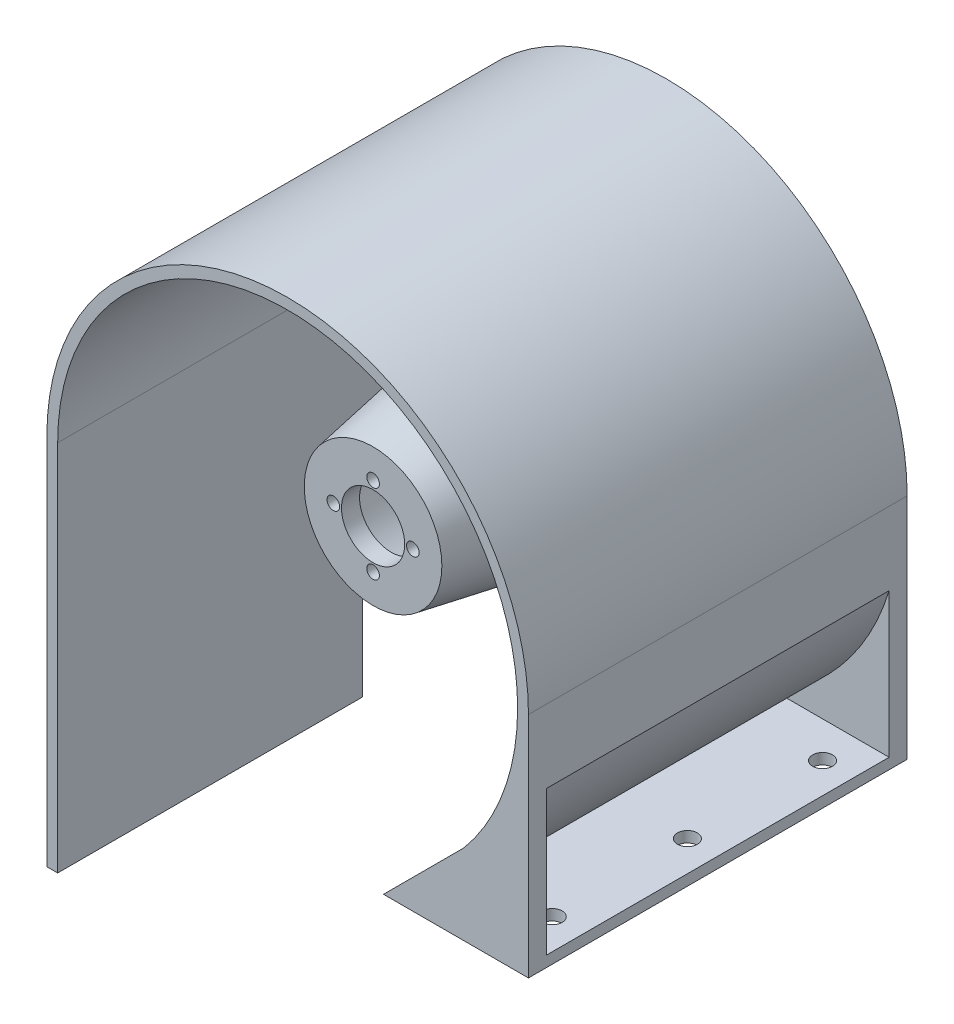
from build123d import *

# Parameters (mm, degrees)
BOSS_EXTRUDE1_DEPTH = 104.85
CUT_EXTRUDE1_REACH  = 178.992
CUT_EXTRUDE2_REACH  = 178.992
SKETCH3_R           = 2.665000000000001
BOSS_EXTRUDE2_DEPTH = 104.85
CUT_EXTRUDE3_REACH  = 178.992
SKETCH6_W           = 66.67499999999998
SKETCH6_H           = 36.500000000000014
CUT_EXTRUDE4_DEPTH  = 3.5
CUT_EXTRUDE5_DEPTH  = 94.850000094
SKETCH9_R           = 2.7500000000000084
SKETCH9_R_2         = 2.750000000000008
CUT_EXTRUDE6_DEPTH  = 5
CUT_EXTRUDE7_DEPTH  = 99.85
BOSS_EXTRUDE3_DEPTH = 40
SKETCH12_R          = 19.05
BOSS_EXTRUDE4_DEPTH = 76.2
CHAMFER1_SIZE       = 13.43611593
CHAMFER1_SIZE_2     = 76.2
CUT_EXTRUDE8_REACH  = 166.091
SKETCH13_R          = 8.750000000000004
CUT_EXTRUDE9_REACH  = 166.091
SKETCH14_R          = 1.7500000000000038
SKETCH14_R_2        = 1.7500000000000067
SKETCH14_R_3        = 1.7499999999999987


# Read off the part's stored shape, not the designer's step: Shell1
with BuildPart() as part:
    # Sketch1 → Boss-Extrude1 (new body)
    with BuildSketch(Plane.XY):
        with BuildLine():
            Line((-34.925, 0), (-34.92499999999999, -63.5))
            Line((-34.92499999999999, -63.5), (-34.92499999999998, -103.175))
            Line((-34.92499999999998, -103.175), (98.425, -103.175))
            Line((98.425, -103.175), (98.42499999999998, -64.83388883768319))
            Line((98.42499999999998, -64.83388883768319), (98.425, 0))
            ThreePointArc((98.425, 0), (31.750000000000004, 66.675), (-34.925, 0))
        make_face()
    extrude(amount=BOSS_EXTRUDE1_DEPTH)

    # Sketch2 → Cut-Extrude1 (cut, up to next)
    with BuildSketch(Plane.XY.offset(104.85), mode=Mode.PRIVATE) as cut_extrude1_sk1:
        with BuildLine():
            Line((31.75, -66.675), (31.75, -103.175))
            Line((31.75, -103.175), (98.425, -103.175))
            Line((98.425, -103.175), (98.425, 0))
            ThreePointArc((98.425, 0), (78.89634463561305, -47.14634463561305), (31.75, -66.675))
        make_face()
    cut_extrude1_tool1 = extrude(cut_extrude1_sk1.sketch, amount=-CUT_EXTRUDE1_REACH, mode=Mode.PRIVATE) & part.part
    add(cut_extrude1_tool1.solids().sort_by_distance((70.281775, -75.59134, 104.85))[0], mode=Mode.SUBTRACT)

    # Sketch3 → Cut-Extrude2 (cut, up to next)
    with BuildSketch(Plane(origin=(0, 0, 0), x_dir=(-1, 0, 0), z_dir=(0, 0, -1)), mode=Mode.PRIVATE) as cut_extrude2_sk1:
        with Locations((-21.75, -93.17500000000001)):
            Circle(SKETCH3_R)
    cut_extrude2_tool1 = extrude(cut_extrude2_sk1.sketch, amount=-CUT_EXTRUDE2_REACH, mode=Mode.PRIVATE) & part.part
    # Sketch3 → Cut-Extrude2 (cut, up to next)
    with BuildSketch(Plane(origin=(0, 0, 0), x_dir=(-1, 0, 0), z_dir=(0, 0, -1)), mode=Mode.PRIVATE) as cut_extrude2_sk2:
        with Locations(Location((-21.75, -73.17499999999998, 0), (0, 0, 180))):
            Circle(SKETCH3_R)
    cut_extrude2_tool2 = extrude(cut_extrude2_sk2.sketch, amount=-CUT_EXTRUDE2_REACH, mode=Mode.PRIVATE) & part.part
    # Sketch3 → Cut-Extrude2 (cut, up to next)
    with BuildSketch(Plane(origin=(0, 0, 0), x_dir=(-1, 0, 0), z_dir=(0, 0, -1)), mode=Mode.PRIVATE) as cut_extrude2_sk3:
        with Locations(Location((24.924999999999997, -93.17500000000001, 0), (0, 0, 180))):
            Circle(SKETCH3_R)
    cut_extrude2_tool3 = extrude(cut_extrude2_sk3.sketch, amount=-CUT_EXTRUDE2_REACH, mode=Mode.PRIVATE) & part.part
    # Sketch3 → Cut-Extrude2 (cut, up to next)
    with BuildSketch(Plane(origin=(0, 0, 0), x_dir=(-1, 0, 0), z_dir=(0, 0, -1)), mode=Mode.PRIVATE) as cut_extrude2_sk4:
        with Locations((24.924999999999997, -73.17499999999998)):
            Circle(SKETCH3_R)
    cut_extrude2_tool4 = extrude(cut_extrude2_sk4.sketch, amount=-CUT_EXTRUDE2_REACH, mode=Mode.PRIVATE) & part.part
    add(cut_extrude2_tool1.solids().sort_by_distance((21.75, -93.175, 0))[0], mode=Mode.SUBTRACT)
    add(cut_extrude2_tool2.solids().sort_by_distance((21.75, -73.175, 0))[0], mode=Mode.SUBTRACT)
    add(cut_extrude2_tool3.solids().sort_by_distance((-24.925, -93.175, 0))[0], mode=Mode.SUBTRACT)
    add(cut_extrude2_tool4.solids().sort_by_distance((-24.925, -73.175, 0))[0], mode=Mode.SUBTRACT)

    # Sketch5 → Boss-Extrude2 (add)
    with BuildSketch(Plane(origin=(0, 0, 0), x_dir=(-1, 0, 0), z_dir=(0, 0, -1))):
        with BuildLine():
            Line((-31.75, -66.675), (-98.425, -66.675))
            Line((-98.425, -66.675), (-98.425, -4.6559e-13))
            ThreePointArc((-98.425, -4.6559e-13), (-78.89634463561288, -47.146344635613225), (-31.75, -66.675))
        make_face()
    extrude(amount=-BOSS_EXTRUDE2_DEPTH)

    # Sketch6 → Cut-Extrude3 (cut, up to next)
    with BuildSketch(Plane(origin=(0, 0, 0), x_dir=(-1, 0, 0), z_dir=(0, 0, -1)), mode=Mode.PRIVATE) as cut_extrude3_sk1:
        with Locations((1.5874999999999897, -84.92500000000001)):
            Rectangle(SKETCH6_W, SKETCH6_H)
    cut_extrude3_tool1 = extrude(cut_extrude3_sk1.sketch, amount=-CUT_EXTRUDE3_REACH, mode=Mode.PRIVATE) & part.part
    add(cut_extrude3_tool1.solids().sort_by_distance((-1.5875, -84.925, 0))[0], mode=Mode.SUBTRACT)

    # Sketch7 → Cut-Extrude4 (cut)
    with BuildSketch(Plane.XZ.offset(66.675)):
        Polygon((98.425, 0), (98.425, 104.85), (-34.92499999999999, 104.85), (-34.92499999999998, 0), align=None)
    extrude(amount=-CUT_EXTRUDE4_DEPTH, mode=Mode.SUBTRACT)

    # Sketch8 → Cut-Extrude5 (cut)
    with BuildSketch(Plane(origin=(0, 0, 4.999999905999999), x_dir=(-1, 0, 0), z_dir=(0, 0, -1))):
        with BuildLine():
            Line((-98.425, -20.224984548819855), (-98.425, -60.17499999999999))
            Line((-98.425, -60.17499999999999), (-66.87228637204589, -60.17499999999999))
            ThreePointArc((-66.87228637204589, -60.17500000000001), (-86.42790057980886, -43.18486787272293), (-98.42499999999998, -20.224984548819855))
        make_face()
    extrude(amount=-CUT_EXTRUDE5_DEPTH, mode=Mode.SUBTRACT)

    # Sketch9 → Cut-Extrude6 (cut)
    with BuildSketch(Plane(origin=(0, -60.17499999999999, 0), x_dir=(1, 0, 0), z_dir=(0, 1, 0))):
        with Locations(Location((89.99999999999999, -89.85, 0), (0, 0, 270))):
            Circle(SKETCH9_R)
        with Locations(Location((89.99999999999999, -14.999999906000001, 0), (0, 0, 270))):
            Circle(SKETCH9_R_2)
        with Locations(Location((89.99999999999999, -52.42499995300001, 0), (0, 0, 270))):
            Circle(SKETCH9_R)
    extrude(amount=-CUT_EXTRUDE6_DEPTH, mode=Mode.SUBTRACT)

    # Sketch10 → Cut-Extrude7 (cut)
    with BuildSketch(Plane.XY.offset(104.85)):
        with BuildLine():
            Line((58.2823809623914, -63.175), (80.527879915601, -40.92950104679029))
            ThreePointArc((80.527879915601, -40.92950104679029), (91.58492762854266, -21.778132626262114), (95.425, -4.6274e-13))
            ThreePointArc((95.42499999999998, -4.6803e-13), (31.75000000000024, 63.67499999999998), (-31.92499999999999, 1.274e-14))
            Line((-31.924999999999994, 7.8e-15), (-31.924999999999994, -63.175))
            Line((-31.924999999999994, -63.175), (31.750000000000004, -63.175))
            Line((31.75, -63.175), (58.2823809623914, -63.175))
        make_face()
    extrude(amount=-CUT_EXTRUDE7_DEPTH, mode=Mode.SUBTRACT)

    # Sketch11 → Boss-Extrude3 (add)
    with BuildSketch(Plane.XZ.offset(63.175)):
        Polygon((-34.92499999999999, 104.85), (-31.924999999999994, 104.85), (-31.924999999999994, 20.5), (-34.92499999999998, 20.5), align=None)
    extrude(amount=BOSS_EXTRUDE3_DEPTH)

    # Sketch12 → Boss-Extrude4 (add)
    with BuildSketch(Plane.XY.offset(5)):
        with Locations(Location((31.75, 0, 0), (0, 0, 180))):
            Circle(SKETCH12_R)
    extrude(amount=BOSS_EXTRUDE4_DEPTH)

    # Chamfer1
    # the kernel refuses this chamfer: 76.2, 13.43611593 mm, written as the material it adds along each edge
    with BuildSketch(Plane(origin=(31.75, 0, 5), x_dir=(-1, 1.2e-16, 0), z_dir=(1.2e-16, 1, 0))) as chamfer1_piece_1_section:
        Polygon((19.05 + CHAMFER1_SIZE, 0), (19.05, CHAMFER1_SIZE_2), (19.05, 0), align=None)
    chamfer1_piece_1 = revolve(axis=Axis((31.75, 0, 5), (0, 0, 1)), mode=Mode.PRIVATE)
    chamfer1_piece_1 = split(chamfer1_piece_1, bisect_by=Plane(origin=(57.33414853673409, -6.27e-15, 81.2), z_dir=(0, 0, -1)), keep=Keep.TOP, mode=Mode.PRIVATE)
    add(chamfer1_piece_1)

    # Shell1 outline → Shell1 (revolve, cut)
    with BuildSketch(Plane(origin=(31.75, 0, 0), x_dir=(1, 0, 0), z_dir=(0, -1, 0))):
        Polygon((14.854501844, 76.2), (0, 76.2), (0, 0), (28.290617774, 0), align=None)
    revolve(axis=Axis((31.75, 0, 0), (0, 0, 1)), mode=Mode.SUBTRACT)

    # Sketch13 → Cut-Extrude8 (cut, up to next)
    with BuildSketch(Plane.XY.offset(81.2), mode=Mode.PRIVATE) as cut_extrude8_sk1:
        with Locations((31.75, 0)):
            Circle(SKETCH13_R)
    cut_extrude8_tool1 = extrude(cut_extrude8_sk1.sketch, amount=-CUT_EXTRUDE8_REACH, mode=Mode.PRIVATE) & part.part
    add(cut_extrude8_tool1.solids().sort_by_distance((31.75, 0, 81.2))[0], mode=Mode.SUBTRACT)

    # Sketch14 → Cut-Extrude9 (cut, up to next)
    with BuildSketch(Plane.XY.offset(81.2), mode=Mode.PRIVATE) as cut_extrude9_sk1:
        with Locations((31.75, 10.999999999999993)):
            Circle(SKETCH14_R)
    cut_extrude9_tool1 = extrude(cut_extrude9_sk1.sketch, amount=-CUT_EXTRUDE9_REACH, mode=Mode.PRIVATE) & part.part
    # Sketch14 → Cut-Extrude9 (cut, up to next)
    with BuildSketch(Plane.XY.offset(81.2), mode=Mode.PRIVATE) as cut_extrude9_sk2:
        with Locations((42.75000000000015, 1.1102e-13)):
            Circle(SKETCH14_R)
    cut_extrude9_tool2 = extrude(cut_extrude9_sk2.sketch, amount=-CUT_EXTRUDE9_REACH, mode=Mode.PRIVATE) & part.part
    # Sketch14 → Cut-Extrude9 (cut, up to next)
    with BuildSketch(Plane.XY.offset(81.2), mode=Mode.PRIVATE) as cut_extrude9_sk3:
        with Locations((31.75000000000024, -10.999999999999993)):
            Circle(SKETCH14_R_2)
    cut_extrude9_tool3 = extrude(cut_extrude9_sk3.sketch, amount=-CUT_EXTRUDE9_REACH, mode=Mode.PRIVATE) & part.part
    # Sketch14 → Cut-Extrude9 (cut, up to next)
    with BuildSketch(Plane.XY.offset(81.2), mode=Mode.PRIVATE) as cut_extrude9_sk4:
        with Locations((20.75000000000016, -3.469e-14)):
            Circle(SKETCH14_R_3)
    cut_extrude9_tool4 = extrude(cut_extrude9_sk4.sketch, amount=-CUT_EXTRUDE9_REACH, mode=Mode.PRIVATE) & part.part
    add(cut_extrude9_tool1.solids().sort_by_distance((31.75, 11, 81.2))[0], mode=Mode.SUBTRACT)
    add(cut_extrude9_tool2.solids().sort_by_distance((42.75, 0, 81.2))[0], mode=Mode.SUBTRACT)
    add(cut_extrude9_tool3.solids().sort_by_distance((31.75, -11, 81.2))[0], mode=Mode.SUBTRACT)
    add(cut_extrude9_tool4.solids().sort_by_distance((20.75, 0, 81.2))[0], mode=Mode.SUBTRACT)


solid = part.part
